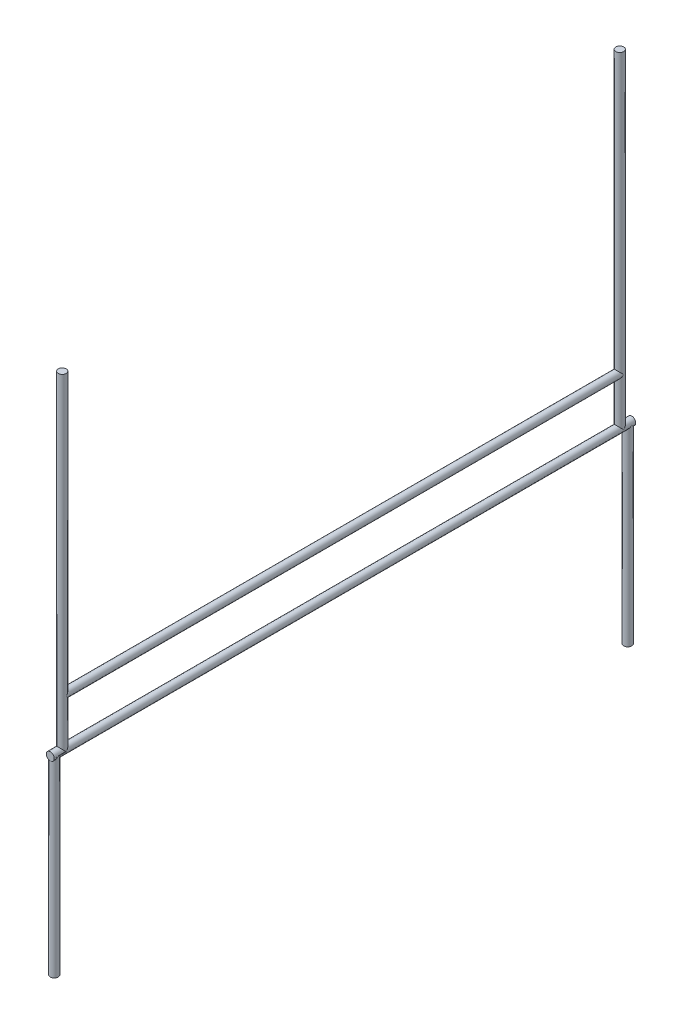
from build123d import *
from build123d.topology import SkipClean

# Parameters (mm, degrees)
SKETCH1_R                            = 50.8
BOSS_EXTRUDE1_DEPTH                  = 2438.4
BOSS_EXTRUDE1_2_DEPTH                = 2438.4
SKETCH4_R                            = 50.8
SKETCH6_R                            = 50.8
BOSS_EXTRUDE2_DEPTH                  = 4178.3
BOSS_EXTRUDE4_REACH                  = 9790.735
BOSS_EXTRUDE4_END_RADIUS             = 50.8
SKETCH7_R                            = 50.8
BOSS_EXTRUDE4_DIRECTION_2_REACH      = 9790.735
BOSS_EXTRUDE4_DIRECTION_2_END_RADIUS = 50.8


with BuildPart() as part:
    # Sketch1 → Boss-Extrude1 (new body)
    with BuildSketch(Plane(origin=(0, 0, 0), x_dir=(1, 0, 0), z_dir=(0, 1, 0))):
        Circle(SKETCH1_R)
    extrude(amount=BOSS_EXTRUDE1_DEPTH)


with BuildPart() as body_2:
    # Sketch1 → Boss-Extrude1 2 (new body)
    with BuildSketch(Plane(origin=(0, 0, 0), x_dir=(1, 0, 0), z_dir=(0, 1, 0))):
        with Locations((0, -7315.2)):
            Circle(SKETCH1_R)
    extrude(amount=BOSS_EXTRUDE1_2_DEPTH)


with BuildPart() as sweep1_tool:
    # Sweep1: sweep along a path in Sketch3
    with SkipClean():  # the faces are left unmerged after this step: merging them gives an invalid solid
        with BuildLine(Plane(origin=(0, 2438.4, 0), x_dir=(1, 0, 0), z_dir=(0, 1, 0))) as sweep1_path:
            Line((0, 50.8), (0, 0))
            Line((0, 0), (0, -7315.2))
            Line((0, -7315.2), (0, -7366))
        # Sketch4 → Sweep1 (sweep)
        with BuildSketch(Plane(origin=(0, 0, -50.8), x_dir=(-1, 0, 0), z_dir=(0, 0, -1))):
            with Locations((0, 2438.4)):
                Circle(SKETCH4_R)
        sweep(path=sweep1_path.line)


with BuildPart() as part_1:
    with SkipClean():  # the faces are left unmerged after this step: merging them gives an invalid solid
        add(part.part)


with BuildPart() as part_2:
    # Sweep1: joined with sweep1_tool
    with SkipClean():  # the faces are left unmerged after this step: merging them gives an invalid solid
        add(part_1.part.fuse(sweep1_tool.part, body_2.part, tol=0.00001))

    # Sketch6 → Boss-Extrude2 (add)
    with SkipClean():  # the faces are left unmerged after this step: merging them gives an invalid solid
        with BuildSketch(Plane(origin=(0, 2438.4, 0), x_dir=(1, 0, 0), z_dir=(0, 1, 0))):
            with Locations((0, -101.6)):
                Circle(SKETCH6_R)
            with Locations((0, -7213.6)):
                Circle(SKETCH6_R)
        extrude(amount=BOSS_EXTRUDE2_DEPTH)

    # Boss-Extrude4: up to this cylinder (the profile starts outside it)
    with SkipClean():  # the faces are left unmerged after this step: merging them gives an invalid solid
        boss_extrude4_end = Plane(origin=(0, 3048, 7213.6), z_dir=(0, -1, 0)) * Cylinder(BOSS_EXTRUDE4_END_RADIUS, 19684.07, mode=Mode.PRIVATE)
        # Sketch7 → Boss-Extrude4 (add, up to the surface)
        with BuildSketch(Plane.XY.offset(152.4), mode=Mode.PRIVATE) as boss_extrude4_sk1:
            with Locations((0, 3048)):
                Circle(SKETCH7_R)
        boss_extrude4_tool1 = extrude(boss_extrude4_sk1.sketch, amount=BOSS_EXTRUDE4_REACH, mode=Mode.PRIVATE) - boss_extrude4_end
        add(boss_extrude4_tool1.solids().sort_by_distance((0, 3048, 152.4))[0])

    # Boss-Extrude4 direction 2: up to this cylinder (the profile starts outside it)
    with SkipClean():  # the faces are left unmerged after this step: merging them gives an invalid solid
        boss_extrude4_direction_2_end = Plane(origin=(0, 3048, 101.6), z_dir=(0, -1, 0)) * Cylinder(BOSS_EXTRUDE4_DIRECTION_2_END_RADIUS, 19684.07, mode=Mode.PRIVATE)
        # Sketch7 → Boss-Extrude4 direction 2 (add, up to the surface)
        with BuildSketch(Plane.XY.offset(152.4), mode=Mode.PRIVATE) as boss_extrude4_direction_2_sk1:
            with Locations((0, 3048)):
                Circle(SKETCH7_R)
        boss_extrude4_direction_2_tool1 = extrude(boss_extrude4_direction_2_sk1.sketch, amount=-BOSS_EXTRUDE4_DIRECTION_2_REACH, mode=Mode.PRIVATE) - boss_extrude4_direction_2_end
        add(boss_extrude4_direction_2_tool1.solids().sort_by_distance((0, 3048, 152.4))[0])
        add(boss_extrude4_direction_2_tool1.solids().sort_by_distance((0, 3048, 152.4))[1])


solid = part_2.part
